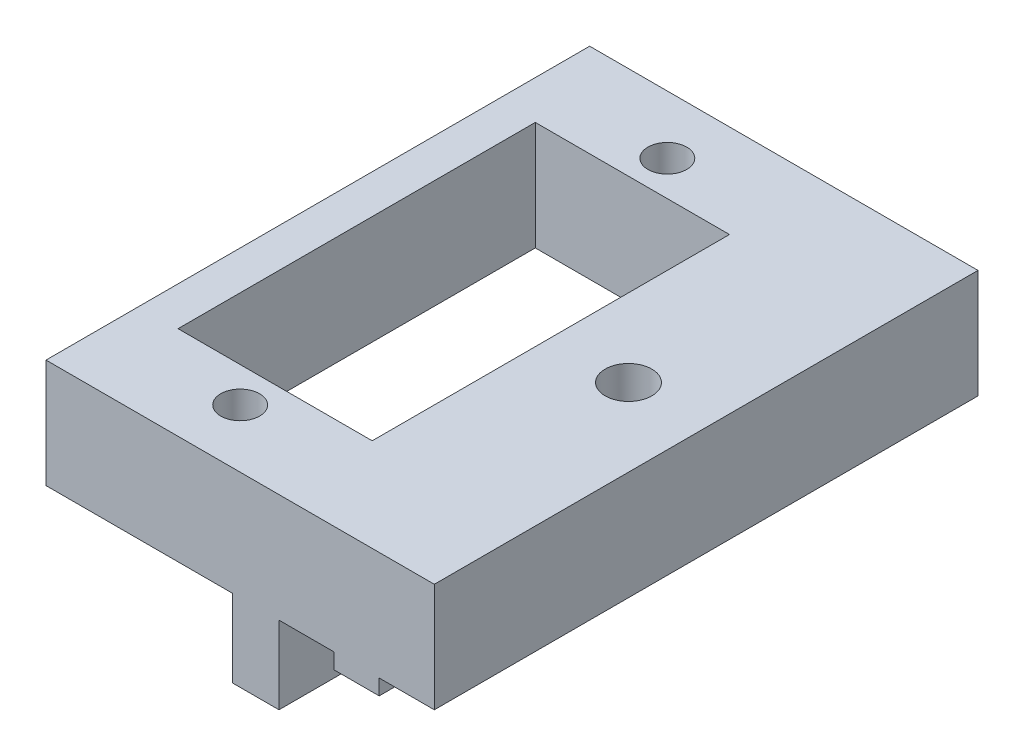
from build123d import *

# Parameters (mm, degrees)
MAIN_DEPTH            = 17.5
SKETCH2_R             = 1.5
SKETCH2_R_2           = 1.25
FIXINGHOLE_DEPTH      = 26.98557292
SKETCH3_W             = 12.5
SKETCH3_H             = 23
SERVOSQUAREHOLE_DEPTH = 26.98557292


with BuildPart() as part:
    # Sketch1 → Main (new, symmetric)
    with BuildSketch(Plane.XY):
        Polygon((10, 0), (10, 7), (-15, 7), (-15, 0), (-3, 0), (-3, -5), (0, -5), (0, 0), (3.55, 0), (3.55, -1), (6.45, -1), (6.45, 0), align=None)
    extrude(amount=MAIN_DEPTH, both=True)

    # Sketch2 → FixingHole (cut, through all)
    with BuildSketch(Plane(origin=(0, 7, 0), x_dir=(1, 0, 0), z_dir=(0, 1, 0))):
        with Locations((5, 0)):
            Circle(SKETCH2_R)
        with Locations((-6.25, 13.75)):
            Circle(SKETCH2_R_2)
        with Locations((-6.25, -13.75)):
            Circle(SKETCH2_R_2)
    extrude(amount=-FIXINGHOLE_DEPTH, mode=Mode.SUBTRACT)

    # Sketch3 → ServoSquareHole (cut, through all)
    with BuildSketch(Plane(origin=(0, 7, 0), x_dir=(1, 0, 0), z_dir=(0, 1, 0))):
        with Locations((-6.25, 0)):
            Rectangle(SKETCH3_W, SKETCH3_H)
    extrude(amount=-SERVOSQUAREHOLE_DEPTH, mode=Mode.SUBTRACT)


solid = part.part
